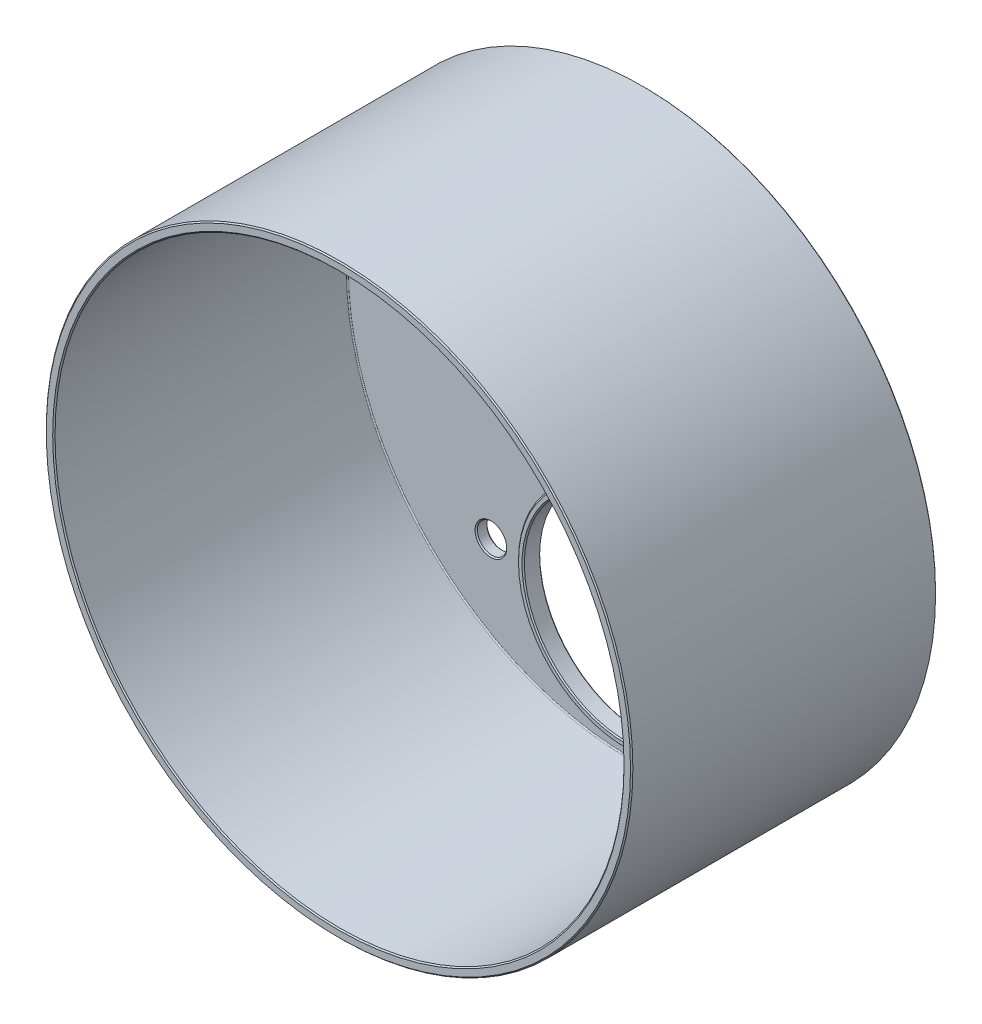
from build123d import *

# Parameters (mm, degrees)
SKETCH_1_R      = 50
SKETCH_1_R_2    = 17.5
SKETCH_1_R_3    = 2.5
EXTRUDE_1_DEPTH = 2
SKETCH_4_R      = 18.5
SKETCH_4_R_2    = 17.5
EXTRUDE_4_DEPTH = 1
SKETCH_5_R      = 50
SKETCH_5_R_2    = 48.5
EXTRUDE_5_DEPTH = 50
FILLET_5_R      = 0.2
CHAMFER_8_SIZE  = 0.2


with BuildPart() as part:
    # Эскиз1 → Бобышка-Вытянуть1 (new body)
    with BuildSketch(Plane.XY):
        with Locations((0, 28)):
            Circle(SKETCH_1_R)
        Circle(SKETCH_1_R_2, mode=Mode.SUBTRACT)
        with Locations((-24, 0)):
            Circle(SKETCH_1_R_3, mode=Mode.SUBTRACT)
        with Locations((24, 0)):
            Circle(SKETCH_1_R_3, mode=Mode.SUBTRACT)
        with Locations((0, 24)):
            Circle(SKETCH_1_R_3, mode=Mode.SUBTRACT)
    extrude(amount=EXTRUDE_1_DEPTH)

    # Эскиз4 → Бобышка-Вытянуть4 (add)
    with BuildSketch(Plane.XY.offset(2)):
        Circle(SKETCH_4_R)
        Circle(SKETCH_4_R_2, mode=Mode.SUBTRACT)
    extrude(amount=EXTRUDE_4_DEPTH)

    # Эскиз5 → Бобышка-Вытянуть5 (add)
    with BuildSketch(Plane.XY.offset(2)):
        with Locations((0, 28)):
            Circle(SKETCH_5_R)
        with Locations((0, 28)):
            Circle(SKETCH_5_R_2, mode=Mode.SUBTRACT)
    extrude(amount=EXTRUDE_5_DEPTH)

    # Скругление5
    fillet_5_edges = [part.edges().sort_by_distance(p)[0] for p in [
        (-48.5, 28, 2),
        (-18.5, 0, 2),
    ]]
    fillet(fillet_5_edges, radius=FILLET_5_R)

    # Фаска8
    chamfer_8_edges = [part.edges().sort_by_distance(p)[0] for p in [
        (-17.5, 0, 3),
        (-18.5, 0, 3),
        (-2.5, 24, 0),
        (21.5, 0, 0),
        (-26.5, 0, 0),
        (-17.5, 0, 0),
        (-50, 28, 0),
        (-48.5, 28, 52),
        (-50, 28, 52),
        (-2.5, 24, 2),
        (-26.5, 0, 2),
        (21.5, 0, 2),
    ]]
    chamfer(chamfer_8_edges, length=CHAMFER_8_SIZE)


solid = part.part
